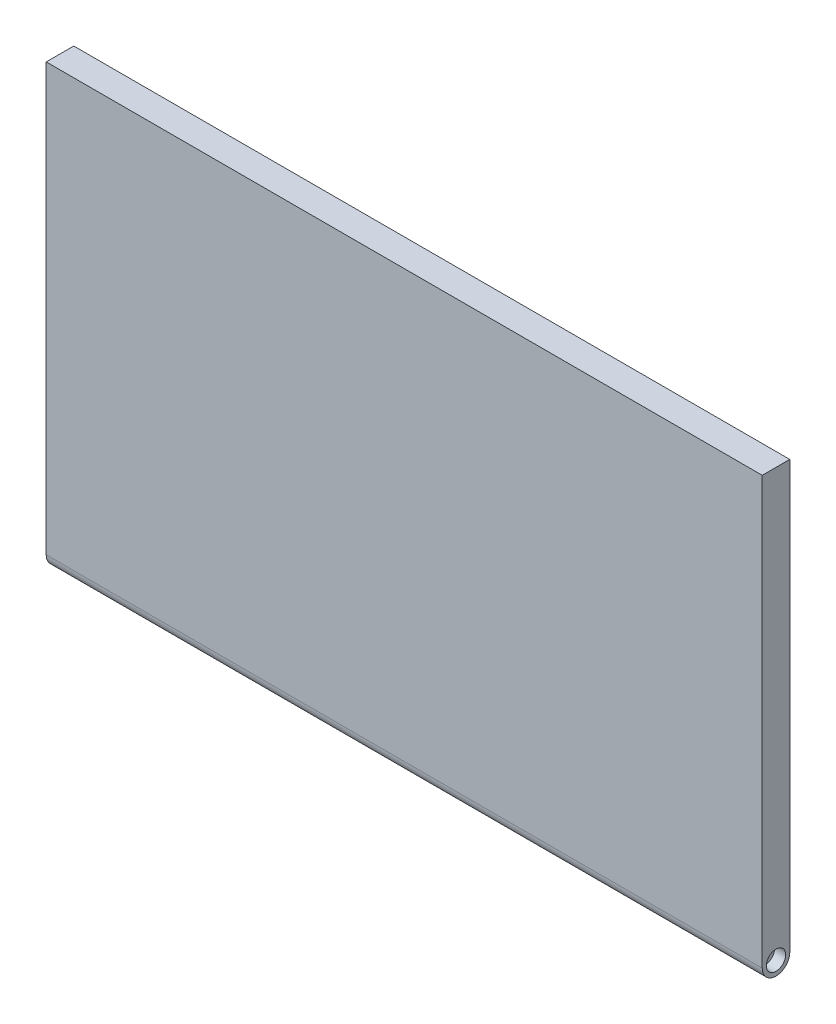
from build123d import *

# Parameters (mm, degrees)
SKETCH1_W           = 130
SKETCH1_H           = 80
BOSS_EXTRUDE1_DEPTH = 5
FILLET1_R           = 2.5
SKETCH2_R           = 1.75
CUT_EXTRUDE1_DEPTH  = 2


with BuildPart() as part:
    # Sketch1 → Boss-Extrude1 (new body)
    with BuildSketch(Plane.XY):
        Rectangle(SKETCH1_W, SKETCH1_H)
    extrude(amount=BOSS_EXTRUDE1_DEPTH)

    # Fillet1
    fillet1_edges = [part.edges().sort_by_distance(p)[0] for p in [
        (0, -40, 0),
        (0, -40, 5),
    ]]
    fillet(fillet1_edges, radius=FILLET1_R - 0.0001)  # a hair under: the kernel refuses the full size

    # Sketch2 → Cut-Extrude1 (cut)
    with BuildSketch(Plane(origin=(65, 0, 0), x_dir=(0, 0, -1), z_dir=(1, 0, 0))):
        with Locations((-2.5, -37.5)):
            Circle(SKETCH2_R)
    extrude(amount=-CUT_EXTRUDE1_DEPTH, mode=Mode.SUBTRACT)


solid = part.part
